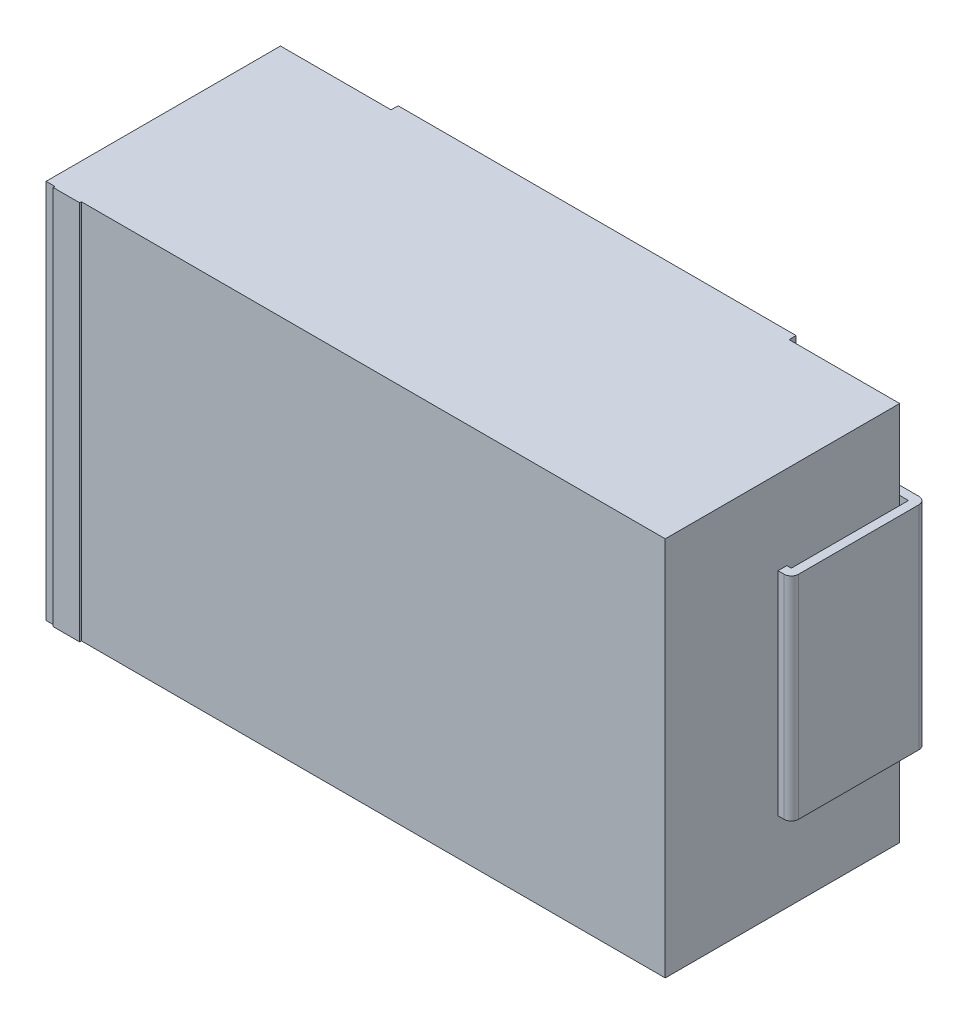
from build123d import *

# Parameters (mm, degrees)
SKETCH_1_W          = 7
SKETCH_1_H          = 4.3
EXTRUDE_1_DEPTH     = 2.65
EXTRUDE_2_DEPTH     = 1.2
SKETCH_3_W          = 4.5
SKETCH_3_H          = 4.3
EXTRUDE_2_2_DEPTH   = 0.08
SKETCH_4_W          = 0.3
SKETCH_4_H          = 4.3
EXTRUDE_3_DEPTH     = 0.02
MOVE_START          = -2.15
MOVE_BODY_1_DEPTH   = 4.3
MOVE_BODY_1_2_DEPTH = 0.95
MOVE_START_2        = 1.2
MOVE_BODY_1_3_DEPTH = 0.95
MOVE_BODY_1_4_DEPTH = 4.3
MOVE_START_3        = -1.2
MOVE_BODY_1_5_DEPTH = 2.4


# Read off the part's stored shape, not the designer's step: Тело-Переместить/Копировать1
with BuildPart() as part:
    # Эскиз1 → Бобышка-Вытянуть1 (new body)
    with BuildSketch(Plane.XY):
        Rectangle(SKETCH_1_W, SKETCH_1_H)
    extrude(amount=EXTRUDE_1_DEPTH)

    # Эскиз2 → Extrude 2 (add, symmetric)
    with BuildSketch(Plane(origin=(0, 0, 0), x_dir=(1, 0, 0), z_dir=(0, 1, 0))):
        with BuildLine():
            Line((-3.5, -1.275), (-3.55, -1.275))
            Line((-3.55, -1.275), (-3.55, 0.05))
            Line((-3.55, 0.05), (-2.35, 0.05))
            Line((-2.35, 0.05), (-2.35, 0.15))
            Line((-2.35, 0.15), (-3.568137941, 0.15))
            ThreePointArc((-3.568137941, 0.15), (-3.626023158, 0.126023158), (-3.65, 0.068137941))
            Line((-3.65, 0.068137941), (-3.65, -1.293137941))
            ThreePointArc((-3.65, -1.293137941), (-3.626023158, -1.351023158), (-3.568137941, -1.375))
            Line((-3.568137941, -1.375), (-3.5, -1.375))
            Line((-3.5, -1.375), (-3.5, -1.275))
        make_face()
    extrude_2 = extrude(amount=EXTRUDE_2_DEPTH, both=True)

    # Эскиз3 → Extrude 2 2 (add)
    with BuildSketch(Plane(origin=(0, 0, 0), x_dir=(-1, 0, 0), z_dir=(0, 0, -1))):
        Rectangle(SKETCH_3_W, SKETCH_3_H)
    extrude(amount=EXTRUDE_2_2_DEPTH)

    # Зеркальное отражение1: Extrude 2 across plane
    add(extrude_2.mirror(Plane(origin=(0, 0, 0), x_dir=(0, 0, 1), z_dir=(1, 0, 0))))

    # Эскиз4 → Бобышка-Вытянуть3 (add)
    with BuildSketch(Plane.XY.offset(2.65)):
        with Locations((-3.25, 0)):
            Rectangle(SKETCH_4_W, SKETCH_4_H)
    extrude(amount=EXTRUDE_3_DEPTH)

    # Move Body 1 outline → Move Body 1 (cut)
    with BuildSketch(Plane(origin=(0, 0, 0), x_dir=(1, 0, 0), z_dir=(0, 1, 0)).offset(MOVE_START)):
        with BuildLine():
            Line((-3.1, -2.65), (-0.525, -2.65))
            Line((-0.525, -2.65), (-0.525, -1.525))
            Line((-0.525, -1.525), (-0.593137941, -1.525))
            ThreePointArc((-0.593137941, -1.525), (-0.651023158, -1.501023158), (-0.675, -1.443137941))
            Line((-0.675, -1.443137941), (-0.675, -0.081862059))
            ThreePointArc((-0.675, -0.081862059), (-0.651023158, -0.023976842), (-0.593137941, 0))
            Line((-0.593137941, 0), (0.625, 0))
            Line((0.625, 0), (0.625, -0.1))
            Line((0.625, -0.1), (-0.575, -0.1))
            Line((-0.575, -0.1), (-0.575, -1.425))
            Line((-0.575, -1.425), (-0.525, -1.425))
            Line((-0.525, -1.425), (-0.525, -0.15))
            Line((-0.525, -0.15), (0.725, -0.15))
            Line((0.725, -0.15), (0.725, -0.07))
            Line((0.725, -0.07), (3.5, -0.07))
            Line((3.5, -0.07), (3.5, 0))
            Line((3.5, 0), (2.25, 0))
            Line((2.25, 0), (2.25, 0.08))
            Line((2.25, 0.08), (-2.25, 0.08))
            Line((-2.25, 0.08), (-2.25, 0))
            Line((-2.25, 0), (-3.5, 0))
            Line((-3.5, 0), (-3.5, -1.275))
            Line((-3.5, -1.275), (-3.55, -1.275))
            Line((-3.55, -1.275), (-3.55, 0.05))
            Line((-3.55, 0.05), (-2.35, 0.05))
            Line((-2.35, 0.05), (-2.35, 0.15))
            Line((-2.35, 0.15), (-3.568137941, 0.15))
            ThreePointArc((-3.568137941, 0.15), (-3.626023158, 0.126023158), (-3.65, 0.068137941))
            Line((-3.65, 0.068137941), (-3.65, -1.293137941))
            ThreePointArc((-3.65, -1.293137941), (-3.626023158, -1.351023158), (-3.568137941, -1.375))
            Line((-3.568137941, -1.375), (-3.5, -1.375))
            Line((-3.5, -1.375), (-3.5, -2.65))
            Line((-3.5, -2.65), (-3.4, -2.65))
            Line((-3.4, -2.65), (-3.4, -2.67))
            Line((-3.4, -2.67), (-3.1, -2.67))
            Line((-3.1, -2.67), (-3.1, -2.65))
        make_face()
        with BuildLine():
            Line((3.55, 0.05), (3.55, -0.07))
            Line((3.55, -0.07), (3.65, -0.07))
            Line((3.65, -0.07), (3.65, 0.068137941))
            ThreePointArc((3.65, 0.068137941), (3.626023158, 0.126023158), (3.568137941, 0.15))
            Line((3.568137941, 0.15), (2.35, 0.15))
            Line((2.35, 0.15), (2.35, 0.05))
            Line((2.35, 0.05), (3.55, 0.05))
        make_face()
    extrude(amount=MOVE_BODY_1_DEPTH, mode=Mode.SUBTRACT)

    # Move Body 1 2 outline → Move Body 1 2 (cut)
    with BuildSketch(Plane(origin=(0, 0, 0), x_dir=(1, 0, 0), z_dir=(0, 1, 0)).offset(MOVE_START)):
        with BuildLine():
            Line((-0.593137941, -1.525), (-0.525, -1.525))
            Line((-0.525, -1.525), (-0.525, -1.425))
            Line((-0.525, -1.425), (-0.575, -1.425))
            Line((-0.575, -1.425), (-0.575, -0.1))
            Line((-0.575, -0.1), (0.625, -0.1))
            Line((0.625, -0.1), (0.625, 0))
            Line((0.625, 0), (-0.593137941, 0))
            ThreePointArc((-0.593137941, 0), (-0.651023158, -0.023976842), (-0.675, -0.081862059))
            Line((-0.675, -0.081862059), (-0.675, -1.443137941))
            ThreePointArc((-0.675, -1.443137941), (-0.651023158, -1.501023158), (-0.593137941, -1.525))
        make_face()
    extrude(amount=MOVE_BODY_1_2_DEPTH, mode=Mode.SUBTRACT)

    # Move Body 1 3 outline → Move Body 1 3 (cut)
    with BuildSketch(Plane(origin=(0, 0, 0), x_dir=(1, 0, 0), z_dir=(0, 1, 0)).offset(MOVE_START_2)):
        with BuildLine():
            Line((-0.593137941, -1.525), (-0.525, -1.525))
            Line((-0.525, -1.525), (-0.525, -1.425))
            Line((-0.525, -1.425), (-0.575, -1.425))
            Line((-0.575, -1.425), (-0.575, -0.1))
            Line((-0.575, -0.1), (0.625, -0.1))
            Line((0.625, -0.1), (0.625, 0))
            Line((0.625, 0), (-0.593137941, 0))
            ThreePointArc((-0.593137941, 0), (-0.651023158, -0.023976842), (-0.675, -0.081862059))
            Line((-0.675, -0.081862059), (-0.675, -1.443137941))
            ThreePointArc((-0.675, -1.443137941), (-0.651023158, -1.501023158), (-0.593137941, -1.525))
        make_face()
    extrude(amount=MOVE_BODY_1_3_DEPTH, mode=Mode.SUBTRACT)

    # Move Body 1 4 outline → Move Body 1 4 (add)
    with BuildSketch(Plane(origin=(0, 0, 0), x_dir=(1, 0, 0), z_dir=(0, 1, 0)).offset(MOVE_START)):
        Polygon((-0.525, -2.8), (-0.425, -2.8), (-0.425, -2.82), (-0.125, -2.82), (-0.125, -2.8), (6.475, -2.8), (6.475, -0.15), (5.225, -0.15), (5.225, -0.07), (3.5, -0.07), (3.5, -2.65), (-0.525, -2.65), align=None)
    extrude(amount=MOVE_BODY_1_4_DEPTH)

    # Move Body 1 5 outline → Move Body 1 5 (add)
    with BuildSketch(Plane(origin=(0, 0, 0), x_dir=(1, 0, 0), z_dir=(0, 1, 0)).offset(MOVE_START_3)):
        with BuildLine():
            Line((6.475, -1.425), (6.475, -1.525))
            Line((6.475, -1.525), (6.543137941, -1.525))
            ThreePointArc((6.543137941, -1.525), (6.601023158, -1.501023158), (6.625, -1.443137941))
            Line((6.625, -1.443137941), (6.625, -0.081862059))
            ThreePointArc((6.625, -0.081862059), (6.601023158, -0.023976842), (6.543137941, 0))
            Line((6.543137941, 0), (5.325, 0))
            Line((5.325, 0), (5.325, -0.1))
            Line((5.325, -0.1), (6.525, -0.1))
            Line((6.525, -0.1), (6.525, -1.425))
            Line((6.525, -1.425), (6.475, -1.425))
        make_face()
    extrude(amount=MOVE_BODY_1_5_DEPTH)


solid = part.part
